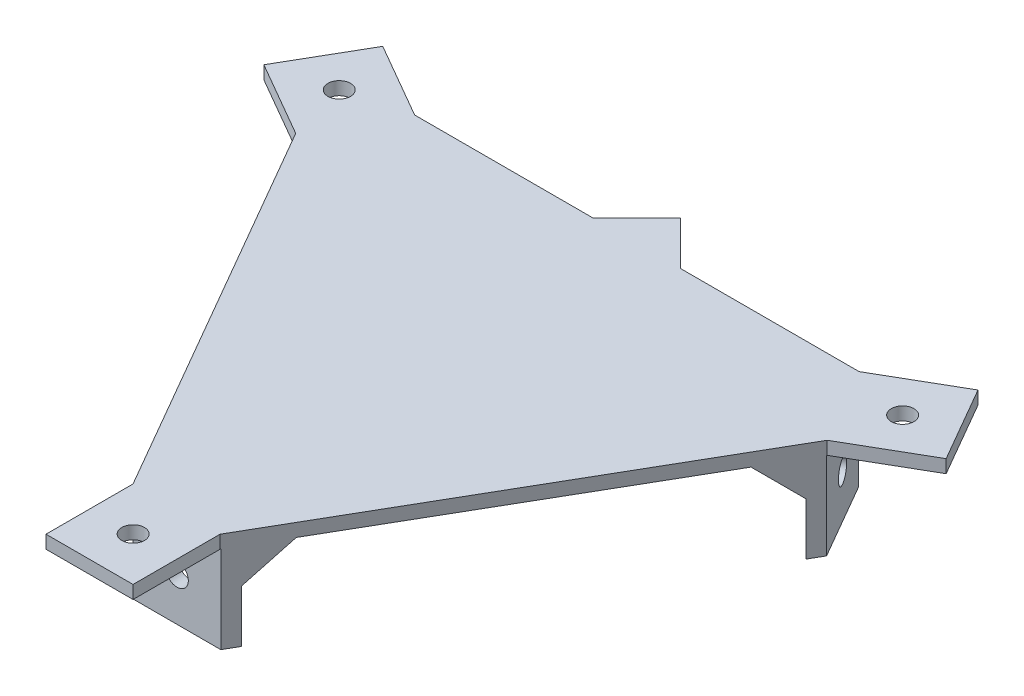
from build123d import *

# Parameters (mm, degrees)
AUFSATZ_LINEAR_AUSTRAGEN1_DEPTH = 3
AUFSATZ_LINEAR_AUSTRAGEN3_DEPTH = 3
AUFSATZ_LINEAR_AUSTRAGEN2_DEPTH = 20
AUFSATZ_LINEAR_AUSTRAGEN4_DEPTH = 8
FASE1_SIZE                      = 8
SCHNITT_LINEAR_AUSTRAGEN1_REACH = 119.702
SKIZZE5_R                       = 2.6
SCHNITT_LINEAR_AUSTRAGEN2_REACH = 178.395
SKIZZE6_R                       = 2.6
SCHNITT_LINEAR_AUSTRAGEN3_REACH = 178.395
SKIZZE7_R                       = 2.6
SCHNITT_LINEAR_AUSTRAGEN4_REACH = 140.701
SKIZZE8_R                       = 2.6


with BuildPart() as part:
    # Skizze1 → Aufsatz-Linear austragen1 (new body)
    with BuildSketch(Plane(origin=(0, 0, 0), x_dir=(1, 0, 0), z_dir=(0, 1, 0))):
        Polygon((-10, -84.737699009), (10, -84.737699009), (10, -64.737699009), (61.064491924, 23.708595467), (78.385, 33.708595467), (68.385, 51.029103542), (51.064491924, 41.029103542), (-51.064491924, 41.029103542), (-68.385, 51.029103542), (-78.385, 33.708595467), (-61.064491924, 23.708595467), (-10, -64.737699009), align=None)
    extrude(amount=AUFSATZ_LINEAR_AUSTRAGEN1_DEPTH)

    # Skizze3 → Aufsatz-Linear austragen3 (add)
    with BuildSketch(Plane.XZ):
        Polygon((0, -51.029103542), (-10, -41.029103542), (10, -41.029103542), align=None)
    extrude(amount=-AUFSATZ_LINEAR_AUSTRAGEN3_DEPTH)

    # Skizze2 → Aufsatz-Linear austragen2 (add)
    with BuildSketch(Plane.XZ):
        Polygon((-10.057735027, 64.637699009), (10.057735027, 64.637699009), (11.789785834, 61.637699009), (-11.789785834, 61.637699009), align=None)
        Polygon((61.006756897, -23.608595467), (50.94902187, -41.029103542), (47.484920255, -41.029103542), (59.27470609, -20.608595467), align=None)
        Polygon((-50.94902187, -41.029103542), (-61.006756897, -23.608595467), (-59.27470609, -20.608595467), (-47.484920255, -41.029103542), align=None)
    extrude(amount=AUFSATZ_LINEAR_AUSTRAGEN2_DEPTH)

    # Skizze4 → Aufsatz-Linear austragen4 (add)
    with BuildSketch(Plane.XZ):
        Polygon((-11.789785834, 61.637699009), (-16.408587988, 53.637699009), (-13.408587988, 53.637699009), (-8.789785834, 61.637699009), align=None)
        Polygon((11.789785834, 61.637699009), (8.789785834, 61.637699009), (13.408587988, 53.637699009), (16.408587988, 53.637699009), align=None)
        Polygon((59.27470609, -20.608595467), (54.655903936, -12.608595467), (53.155903936, -15.206671678), (57.77470609, -23.206671678), align=None)
        Polygon((47.484920255, -41.029103542), (48.984920255, -38.431027331), (39.747315948, -38.431027331), (38.247315948, -41.029103542), align=None)
        Polygon((-47.484920255, -41.029103542), (-38.247315948, -41.029103542), (-39.747315948, -38.431027331), (-48.984920255, -38.431027331), align=None)
        Polygon((-59.27470609, -20.608595467), (-57.77470609, -23.206671678), (-53.155903936, -15.206671678), (-54.655903936, -12.608595467), align=None)
    extrude(amount=AUFSATZ_LINEAR_AUSTRAGEN4_DEPTH)

    # Fase1
    # the kernel refuses this chamfer: 8 mm, written as the material it takes off along each edge
    with BuildSketch(Plane(origin=(-42.869171984, -8, -33.023814062), x_dir=(0.023812127644089447, 0.9996219169112968, 0.013747938305292782), z_dir=(-0.5000000000000003, 0, 0.8660254037844386))) as fase1_piece_1_section:
        Polygon((FASE1_SIZE * 0.999621916911, FASE1_SIZE * 0.0274958766106), (-FASE1_SIZE * 0.0274958766106, FASE1_SIZE * 0.999621916911), (0, 0), align=None)
    fase1_piece_1 = extrude(amount=44.146927807, mode=Mode.PRIVATE)
    fase1_piece_1 = split(fase1_piece_1, bisect_by=Plane(origin=(-56.186972779, 0, -15.224609283), z_dir=(0, -1, 0)), keep=Keep.TOP, mode=Mode.PRIVATE)
    add(fase1_piece_1, mode=Mode.SUBTRACT)
    with BuildSketch(Plane(origin=(-27.960583996, -8, -58.846245927), x_dir=(0.02381212764409005, 0.9996219169112968, 0.013747938305293118), z_dir=(-0.5, 0, 0.8660254037844387))) as fase1_piece_2_section:
        Polygon((FASE1_SIZE * 0.999621916911, FASE1_SIZE * 0.0274958766106), (-FASE1_SIZE * 0.0274958766106, FASE1_SIZE * 0.999621916911), (0, 0), align=None)
    fase1_piece_2 = extrude(amount=44.146927807, mode=Mode.PRIVATE)
    fase1_piece_2 = split(fase1_piece_2, bisect_by=Plane(origin=(-41.278384791, 0, -41.047041147), z_dir=(0, -1, 0)), keep=Keep.TOP, mode=Mode.PRIVATE)
    add(fase1_piece_2, mode=Mode.SUBTRACT)
    with BuildSketch(Plane(origin=(50.0340479, -8, -20.613884946), x_dir=(-0.023812127644090117, 0.9996219169112968, 0.013747938305293118), z_dir=(-0.49999999999999895, 0, -0.8660254037844393))) as fase1_piece_3_section:
        Polygon((FASE1_SIZE * 0.999621916911, FASE1_SIZE * 0.0274958766106), (-FASE1_SIZE * 0.0274958766106, FASE1_SIZE * 0.999621916911), (0, 0), align=None)
    fase1_piece_3 = extrude(amount=44.146927807, mode=Mode.PRIVATE)
    fase1_piece_3 = split(fase1_piece_3, bisect_by=Plane(origin=(41.278384791, 0, -41.047041147), z_dir=(0, -1, 0)), keep=Keep.TOP, mode=Mode.PRIVATE)
    add(fase1_piece_3, mode=Mode.SUBTRACT)
    with BuildSketch(Plane(origin=(64.942635888, -8, 5.208546918), x_dir=(-0.023812127644090537, 0.9996219169112968, 0.013747938305293455), z_dir=(-0.5000000000000016, 0, -0.8660254037844378))) as fase1_piece_4_section:
        Polygon((FASE1_SIZE * 0.999621916911, FASE1_SIZE * 0.0274958766106), (-FASE1_SIZE * 0.0274958766106, FASE1_SIZE * 0.999621916911), (0, 0), align=None)
    fase1_piece_4 = extrude(amount=44.146927807, mode=Mode.PRIVATE)
    fase1_piece_4 = split(fase1_piece_4, bisect_by=Plane(origin=(56.186972779, 0, -15.224609283), z_dir=(0, -1, 0)), keep=Keep.TOP, mode=Mode.PRIVATE)
    add(fase1_piece_4, mode=Mode.SUBTRACT)
    with BuildSketch(Plane(origin=(-7.164875916, -8, 53.637699009), x_dir=(0, -0.02749587661058627, 0.9996219169112968), z_dir=(1, 0, 0))) as fase1_piece_5_section:
        Polygon((FASE1_SIZE * 0.999621916911, -FASE1_SIZE * 0.0274958766106), (-FASE1_SIZE * 0.0274958766106, -FASE1_SIZE * 0.999621916911), (0, 0), align=None)
    fase1_piece_5 = extrude(amount=44.146927807, mode=Mode.PRIVATE)
    fase1_piece_5 = split(fase1_piece_5, bisect_by=Plane(origin=(14.908587988, 0, 61.735979971), z_dir=(0, -1, 0)), keep=Keep.TOP, mode=Mode.PRIVATE)
    add(fase1_piece_5, mode=Mode.SUBTRACT)
    with BuildSketch(Plane(origin=(-36.982051892, -8, 53.637699009), x_dir=(0, 0.9996219169112968, -0.027495876610586494), z_dir=(1, 0, 0))) as fase1_piece_6_section:
        Polygon((FASE1_SIZE * 0.999621916911, FASE1_SIZE * 0.0274958766106), (-FASE1_SIZE * 0.0274958766106, FASE1_SIZE * 0.999621916911), (0, 0), align=None)
    fase1_piece_6 = extrude(amount=44.146927807, mode=Mode.PRIVATE)
    fase1_piece_6 = split(fase1_piece_6, bisect_by=Plane(origin=(-14.908587988, 0, 56.27165043), z_dir=(0, -1, 0)), keep=Keep.TOP, mode=Mode.PRIVATE)
    add(fase1_piece_6, mode=Mode.SUBTRACT)

    # Skizze5 → Schnitt-Linear austragen1 (cut, up to next)
    with BuildSketch(Plane(origin=(0, 3, 0), x_dir=(1, 0, 0), z_dir=(0, 1, 0)), mode=Mode.PRIVATE) as schnitt_linear_austragen1_sk1:
        with Locations(Location((-64.724745962, 37.368849504, 0), (0, 0, 270))):
            Circle(SKIZZE5_R)
    schnitt_linear_austragen1_tool1 = extrude(schnitt_linear_austragen1_sk1.sketch, amount=-SCHNITT_LINEAR_AUSTRAGEN1_REACH, mode=Mode.PRIVATE) & part.part
    # Skizze5 → Schnitt-Linear austragen1 (cut, up to next)
    with BuildSketch(Plane(origin=(0, 3, 0), x_dir=(1, 0, 0), z_dir=(0, 1, 0)), mode=Mode.PRIVATE) as schnitt_linear_austragen1_sk2:
        with Locations(Location((64.724745962, 37.368849504, 0), (0, 0, 270))):
            Circle(SKIZZE5_R)
    schnitt_linear_austragen1_tool2 = extrude(schnitt_linear_austragen1_sk2.sketch, amount=-SCHNITT_LINEAR_AUSTRAGEN1_REACH, mode=Mode.PRIVATE) & part.part
    # Skizze5 → Schnitt-Linear austragen1 (cut, up to next)
    with BuildSketch(Plane(origin=(0, 3, 0), x_dir=(1, 0, 0), z_dir=(0, 1, 0)), mode=Mode.PRIVATE) as schnitt_linear_austragen1_sk3:
        with Locations(Location((-0.028867513, -74.687699009, 0), (0, 0, 270))):
            Circle(SKIZZE5_R)
    schnitt_linear_austragen1_tool3 = extrude(schnitt_linear_austragen1_sk3.sketch, amount=-SCHNITT_LINEAR_AUSTRAGEN1_REACH, mode=Mode.PRIVATE) & part.part
    add(schnitt_linear_austragen1_tool1.solids().sort_by_distance((-64.724746, 3, -37.36885))[0], mode=Mode.SUBTRACT)
    add(schnitt_linear_austragen1_tool2.solids().sort_by_distance((64.724746, 3, -37.36885))[0], mode=Mode.SUBTRACT)
    add(schnitt_linear_austragen1_tool3.solids().sort_by_distance((-0.028868, 3, 74.687699))[0], mode=Mode.SUBTRACT)

    # Skizze6 → Schnitt-Linear austragen2 (cut, up to next)
    with BuildSketch(Plane(origin=(53.379813173, 0, -30.818849504), x_dir=(0.49999999999999967, 0, 0.8660254037844389), z_dir=(-0.8660254037844389, 0, 0.49999999999999967)), mode=Mode.PRIVATE) as schnitt_linear_austragen2_sk1:
        with Locations((0, -10)):
            Circle(SKIZZE6_R)
    schnitt_linear_austragen2_tool1 = extrude(schnitt_linear_austragen2_sk1.sketch, amount=-SCHNITT_LINEAR_AUSTRAGEN2_REACH, mode=Mode.PRIVATE) & part.part
    add(schnitt_linear_austragen2_tool1.solids().sort_by_distance((53.379813, -10, -30.81885))[0], mode=Mode.SUBTRACT)

    # Skizze7 → Schnitt-Linear austragen3 (cut, up to next)
    with BuildSketch(Plane(origin=(-53.379813173, 0, -30.818849504), x_dir=(0.5000000000000007, 0, -0.8660254037844383), z_dir=(0.8660254037844383, 0, 0.5000000000000007)), mode=Mode.PRIVATE) as schnitt_linear_austragen3_sk1:
        with Locations((0, -10)):
            Circle(SKIZZE7_R)
    schnitt_linear_austragen3_tool1 = extrude(schnitt_linear_austragen3_sk1.sketch, amount=-SCHNITT_LINEAR_AUSTRAGEN3_REACH, mode=Mode.PRIVATE) & part.part
    add(schnitt_linear_austragen3_tool1.solids().sort_by_distance((-53.379813, -10, -30.81885))[0], mode=Mode.SUBTRACT)

    # Skizze8 → Schnitt-Linear austragen4 (cut, up to next)
    with BuildSketch(Plane(origin=(0, 0, 61.637699009), x_dir=(-1, 0, 0), z_dir=(0, 0, -1)), mode=Mode.PRIVATE) as schnitt_linear_austragen4_sk1:
        with Locations((0, -10)):
            Circle(SKIZZE8_R)
    schnitt_linear_austragen4_tool1 = extrude(schnitt_linear_austragen4_sk1.sketch, amount=-SCHNITT_LINEAR_AUSTRAGEN4_REACH, mode=Mode.PRIVATE) & part.part
    add(schnitt_linear_austragen4_tool1.solids().sort_by_distance((0, -10, 61.637699))[0], mode=Mode.SUBTRACT)


solid = part.part
